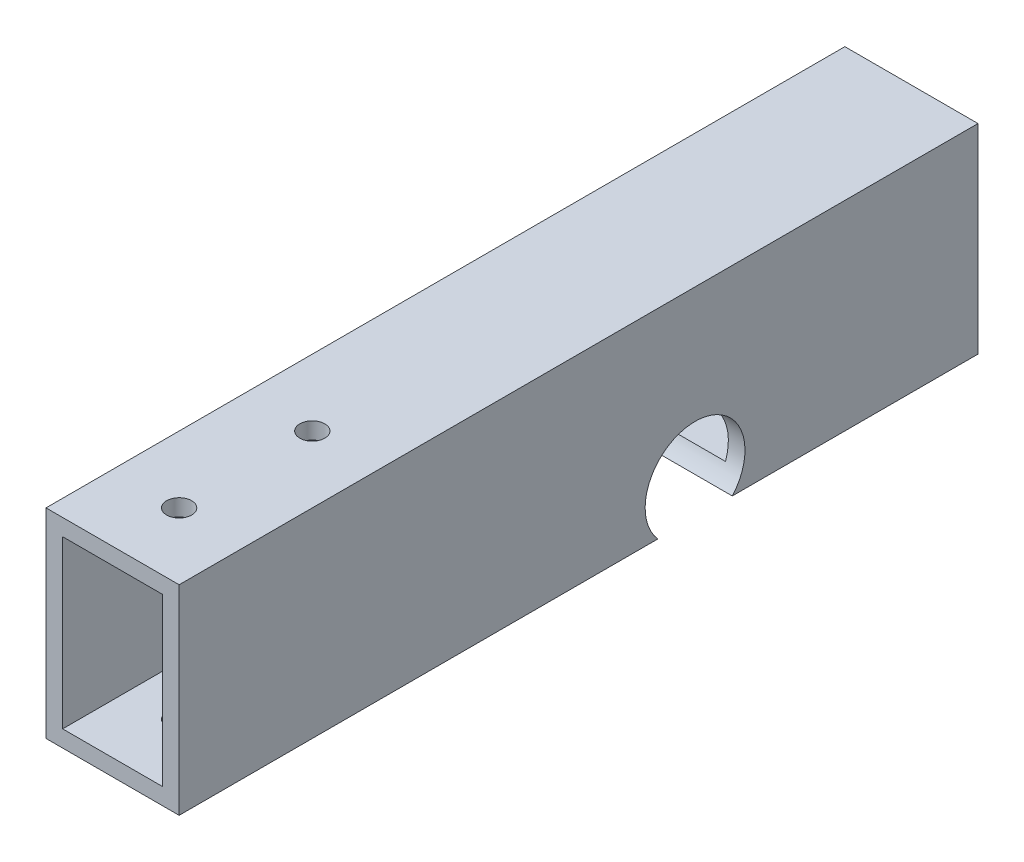
from build123d import *

# Parameters (mm, degrees)
SKETCH1_W           = 25.4
SKETCH1_H           = 38.1
BOSS_EXTRUDE1_DEPTH = 152.4
SHELL1_T            = -3.175
SKETCH2_R           = 9.525
CUT_EXTRUDE1_DEPTH  = 156.672163536
SKETCH3_R           = 2.38125
CUT_EXTRUDE2_DEPTH  = 158.602855304


with BuildPart() as part:
    # Sketch1 → Boss-Extrude1 (new body)
    with BuildSketch(Plane.XY):
        Rectangle(SKETCH1_W, SKETCH1_H)
    extrude(amount=BOSS_EXTRUDE1_DEPTH)

    # Shell1
    shell1_openings = [part.faces().sort_by_distance(p)[0] for p in [
        (0, 0, 0),
        (0, 0, 152.4),
    ]]
    offset(amount=SHELL1_T, openings=shell1_openings, kind=Kind.INTERSECTION)

    # Sketch2 → Cut-Extrude1 (cut, through all)
    with BuildSketch(Plane(origin=(12.7, 0, 0), x_dir=(0, 0, -1), z_dir=(1, 0, 0))):
        with Locations((-53.975, -12.7)):
            Circle(SKETCH2_R)
    extrude(amount=-CUT_EXTRUDE1_DEPTH, mode=Mode.SUBTRACT)

    # Sketch3 → Cut-Extrude2 (cut, through all)
    with BuildSketch(Plane(origin=(0, 19.05, 0), x_dir=(1, 0, 0), z_dir=(0, 1, 0))):
        with Locations((0, -139.7)):
            Circle(SKETCH3_R)
        with Locations((0, -114.3)):
            Circle(SKETCH3_R)
    extrude(amount=-CUT_EXTRUDE2_DEPTH, mode=Mode.SUBTRACT)


solid = part.part
